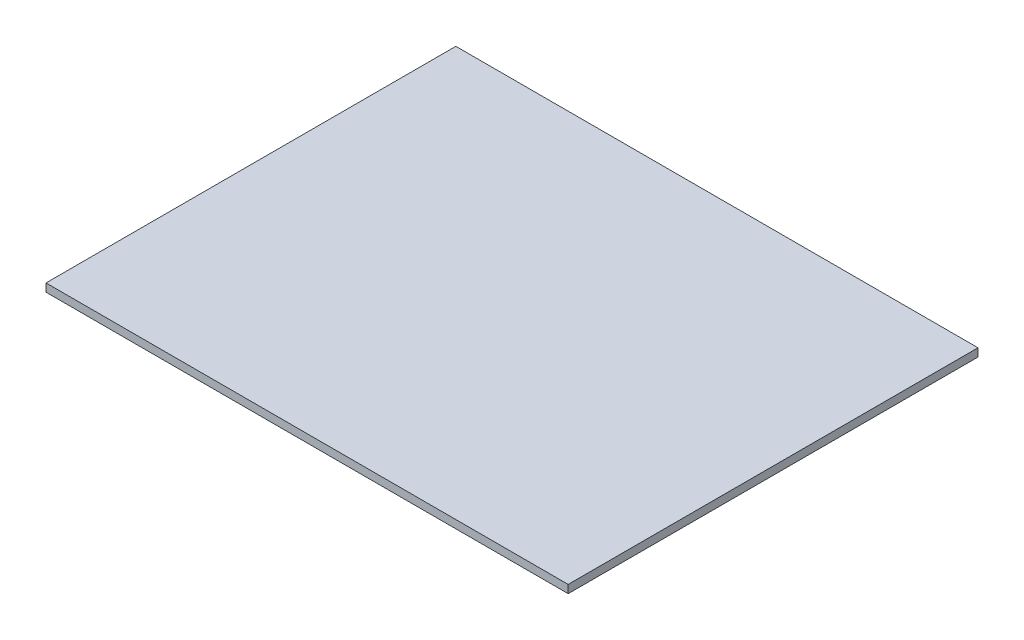
from build123d import *

# Parameters (mm, degrees)
SKETCH1_W           = 64.85
SKETCH1_H           = 50.9
BOSS_EXTRUDE1_DEPTH = 1


with BuildPart() as part:
    # Sketch1 → Boss-Extrude1 (new body)
    with BuildSketch(Plane(origin=(0, 0, 0), x_dir=(1, 0, 0), z_dir=(0, 1, 0))):
        Rectangle(SKETCH1_W, SKETCH1_H)
    extrude(amount=BOSS_EXTRUDE1_DEPTH)


solid = part.part
